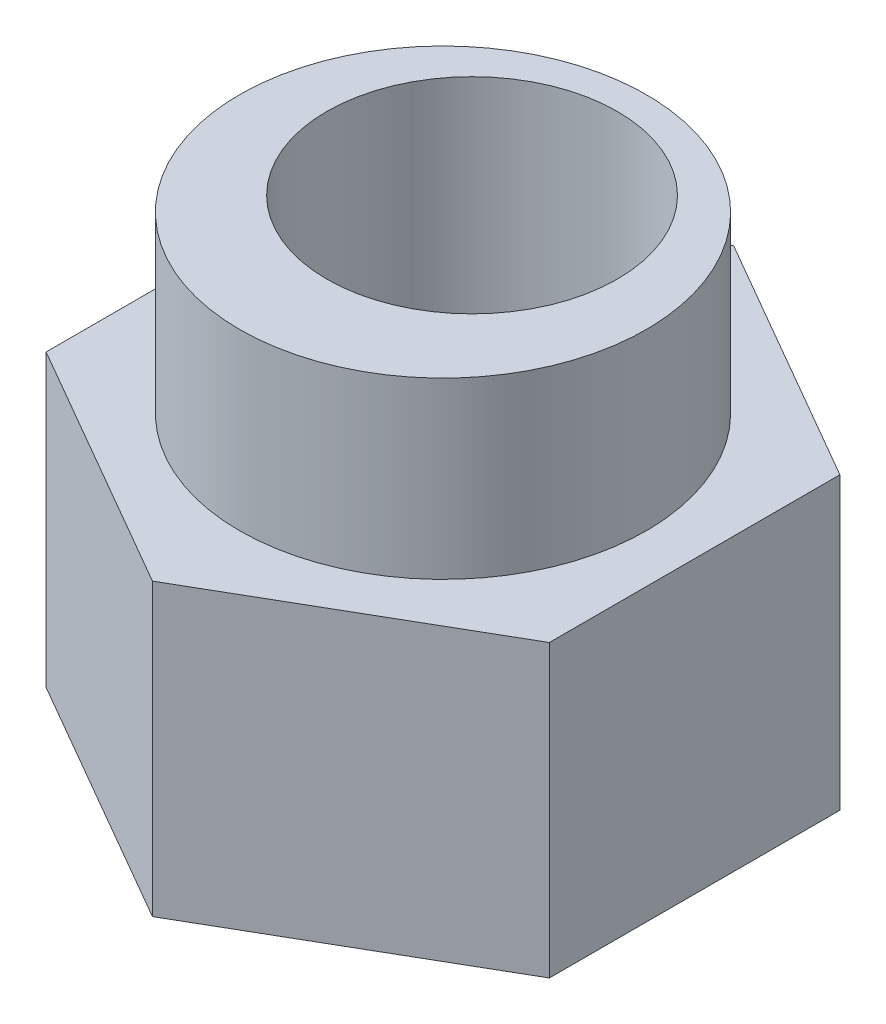
from build123d import *

# Parameters (mm, degrees)
BOSS_EXTRUDE1_DEPTH = 8
SKETCH2_R           = 2.5
CUT_EXTRUDE1_DEPTH  = 8
SKETCH3_R           = 3.5
CUT_EXTRUDE2_DEPTH  = 3


with BuildPart() as part:
    # Sketch1 → Boss-Extrude1 (new body)
    with BuildSketch(Plane(origin=(0, 0, 0), x_dir=(1, 0, 0), z_dir=(0, 1, 0))):
        Polygon((4.330127019, 2.5), (0, 5), (-4.330127019, 2.5), (-4.330127019, -2.5), (0, -5), (4.330127019, -2.5), align=None)
    extrude(amount=BOSS_EXTRUDE1_DEPTH)

    # Sketch2 → Cut-Extrude1 (cut)
    with BuildSketch(Plane(origin=(0, 8, 0), x_dir=(1, 0, 0), z_dir=(0, 1, 0))):
        with Locations((0, 0.5)):
            Circle(SKETCH2_R)
    extrude(amount=-CUT_EXTRUDE1_DEPTH, mode=Mode.SUBTRACT)

    # Sketch3 → Cut-Extrude2 (cut)
    with BuildSketch(Plane(origin=(0, 8, 0), x_dir=(1, 0, 0), z_dir=(0, 1, 0))):
        Polygon((-4.330127019, 2.5), (-4.330127019, -2.5), (0, -5), (4.330127019, -2.5), (4.330127019, 2.5), (0, 5), align=None)
        Circle(SKETCH3_R, mode=Mode.SUBTRACT)
    extrude(amount=-CUT_EXTRUDE2_DEPTH, mode=Mode.SUBTRACT)


solid = part.part
